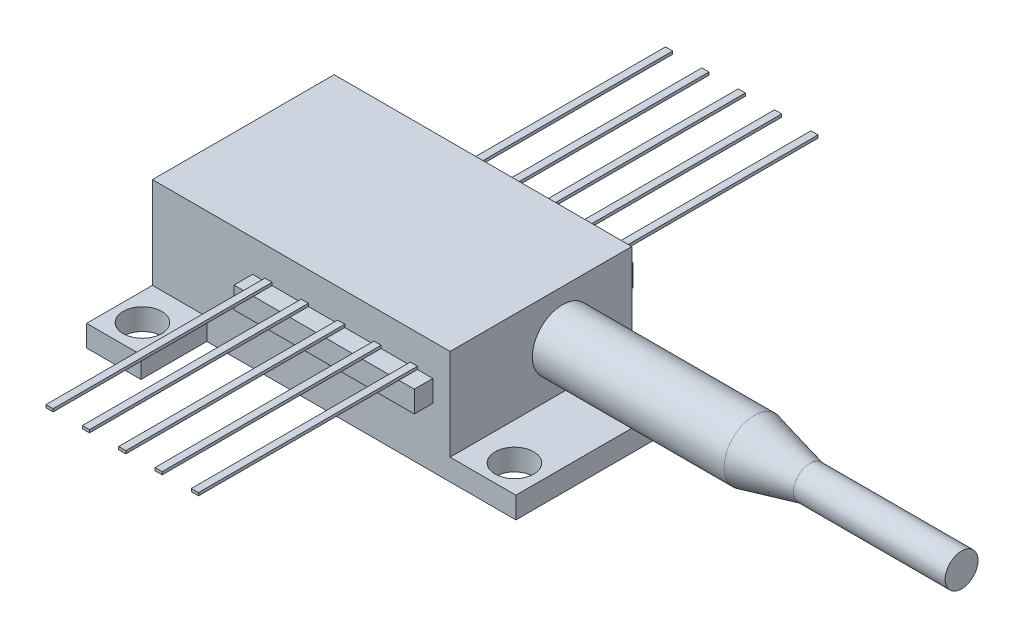
from build123d import *

# Parameters (mm, degrees)
SKETCH1_W               = 20.8
SKETCH1_H               = 12.7
BOSS_EXTRUDE1_DEPTH     = 6.4
BOSS_EXTRUDE2_DEPTH     = 1.5
SKETCH5_R               = 1.35
CUT_EXTRUDE1_DEPTH      = 21.181984541
SKETCH9_W               = 12.6
SKETCH9_H               = 1.3
BOSS_EXTRUDE4_DEPTH     = 1.5
SKETCH10_W              = 0.5
SKETCH10_H              = 15.3
BOSS_EXTRUDE5_DEPTH     = 0.2
LPATTERN1_COUNT         = 5
LPATTERN1_PITCH         = 2.54
MIRROR2_COPY_1_SKETCH_W = 0.5
MIRROR2_COPY_1_SKETCH_H = 15.3
MIRROR2_COPY_1_DEPTH    = 0.2
MIRROR2_COPY_2_SKETCH_W = 0.5
MIRROR2_COPY_2_SKETCH_H = 15.3
MIRROR2_COPY_2_DEPTH    = 0.2
MIRROR2_COPY_3_SKETCH_W = 0.5
MIRROR2_COPY_3_SKETCH_H = 15.3
MIRROR2_COPY_3_DEPTH    = 0.2
MIRROR2_COPY_4_SKETCH_W = 0.5
MIRROR2_COPY_4_SKETCH_H = 15.3
MIRROR2_COPY_4_DEPTH    = 0.2


with BuildPart() as part:
    # Sketch1 → Boss-Extrude1 (new body)
    with BuildSketch(Plane(origin=(0, 0, 0), x_dir=(1, 0, 0), z_dir=(0, 1, 0))):
        Rectangle(SKETCH1_W, SKETCH1_H)
    extrude(amount=BOSS_EXTRUDE1_DEPTH)

    # Sketch3 → Boss-Extrude2 (add)
    with BuildSketch(Plane.XZ):
        Polygon((-10.4, 10.95), (-6.6, 10.95), (-6.6, 6.35), (15, 6.35), (15, -6.35), (-6.6, -6.35), (-6.6, -10.95), (-10.4, -10.95), align=None)
    extrude(amount=BOSS_EXTRUDE2_DEPTH)

    # Sketch5 → Cut-Extrude1 (cut, through all)
    with BuildSketch(Plane.XZ.offset(1.5)):
        with Locations((-8.5, 8.95)):
            Circle(SKETCH5_R)
        with Locations((13, 4.45)):
            Circle(SKETCH5_R)
    cut_extrude1 = extrude(amount=-CUT_EXTRUDE1_DEPTH, mode=Mode.SUBTRACT)

    # Mirror3: Cut-Extrude1 across plane
    add(cut_extrude1.mirror(Plane.XY), mode=Mode.SUBTRACT)

    # Sketch11 → Revolve1 (revolve)
    with BuildSketch(Plane(origin=(0, 3.2, 0), x_dir=(-1, 0, 0), z_dir=(0, -1, 0))):
        Polygon((-10.4, 1.5), (-10.4, 3.6), (-23.8, 3.6), (-27.7, 2.65), (-38.3, 2.65), (-38.3, 1.5), align=None)
    revolve(axis=Axis((10.4, 3.2, -1.5), (1, 0, 0)))

    # Sketch9 → Boss-Extrude4 (add)
    with BuildSketch(Plane(origin=(0, 2.665, 0), x_dir=(-1, 0, 0), z_dir=(0, -1, 0))):
        with Locations((-2.9, -7)):
            Rectangle(SKETCH9_W, SKETCH9_H)
    boss_extrude4 = extrude(amount=-BOSS_EXTRUDE4_DEPTH)

    # Sketch10 → Boss-Extrude5 (add)
    with BuildSketch(Plane(origin=(0, 4.165, 0), x_dir=(1, 0, 0), z_dir=(0, 1, 0))):
        with Locations((7.87, -14)):
            Rectangle(SKETCH10_W, SKETCH10_H)
    boss_extrude5 = extrude(amount=BOSS_EXTRUDE5_DEPTH)

    # LPattern1: Boss-Extrude5 ×5
    with Locations(*[(-i * LPATTERN1_PITCH, 0, 0) for i in range(1, LPATTERN1_COUNT)]):
        add(boss_extrude5)

    # Mirror2: Boss-Extrude4, Boss-Extrude5 across plane
    add(boss_extrude4.mirror(Plane.XY))
    add(boss_extrude5.mirror(Plane.XY))

    # Mirror2 copy 1 sketch → Mirror2 copy 1 (add)
    with BuildSketch(Plane(origin=(-2.54, 4.165, 0), x_dir=(1, 0, 0), z_dir=(0, 1, 0))):
        with Locations((7.87, 14)):
            Rectangle(MIRROR2_COPY_1_SKETCH_W, MIRROR2_COPY_1_SKETCH_H)
    extrude(amount=MIRROR2_COPY_1_DEPTH)

    # Mirror2 copy 2 sketch → Mirror2 copy 2 (add)
    with BuildSketch(Plane(origin=(-5.08, 4.165, 0), x_dir=(1, 0, 0), z_dir=(0, 1, 0))):
        with Locations((7.87, 14)):
            Rectangle(MIRROR2_COPY_2_SKETCH_W, MIRROR2_COPY_2_SKETCH_H)
    extrude(amount=MIRROR2_COPY_2_DEPTH)

    # Mirror2 copy 3 sketch → Mirror2 copy 3 (add)
    with BuildSketch(Plane(origin=(-7.62, 4.165, 0), x_dir=(1, 0, 0), z_dir=(0, 1, 0))):
        with Locations((7.87, 14)):
            Rectangle(MIRROR2_COPY_3_SKETCH_W, MIRROR2_COPY_3_SKETCH_H)
    extrude(amount=MIRROR2_COPY_3_DEPTH)

    # Mirror2 copy 4 sketch → Mirror2 copy 4 (add)
    with BuildSketch(Plane(origin=(-10.16, 4.165, 0), x_dir=(1, 0, 0), z_dir=(0, 1, 0))):
        with Locations((7.87, 14)):
            Rectangle(MIRROR2_COPY_4_SKETCH_W, MIRROR2_COPY_4_SKETCH_H)
    extrude(amount=MIRROR2_COPY_4_DEPTH)


solid = part.part
